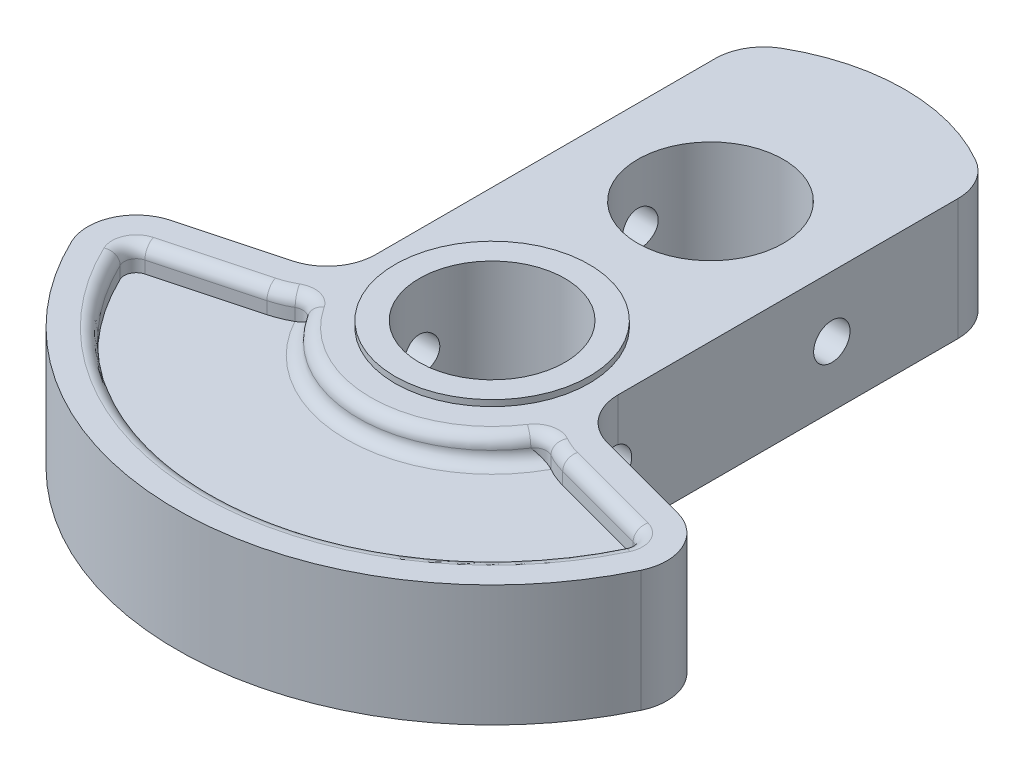
from build123d import *

# Parameters (mm, degrees)
BOSS_EXTRUDE1_DEPTH     = 5
FILLET1_R               = 4
SKETCH3_R               = 8
BOSS_EXTRUDE2_DEPTH     = 0.5
SKETCH4_R               = 8
BOSS_EXTRUDE3_DEPTH     = 0.5
SKETCH5_R               = 6
CUT_EXTRUDE2_DEPTH      = 43.969085178
CUT_EXTRUDE3_DEPTH      = 2
FILLET4_R               = 1
FILLET4_OF_MIRROR1_R    = 1
CUT_EXTRUDE4_DEPTH      = 42.899788556
CUT_EXTRUDE4_DEPTH_BACK = 42.899788556
SKETCH7_R               = 1.5


with BuildPart() as part:
    # Sketch1 → Boss-Extrude1 (new, symmetric)
    with BuildSketch(Plane(origin=(0, 0, 0), x_dir=(1, 0, 0), z_dir=(0, 1, 0))):
        with BuildLine():
            Line((-10, 30.489995997), (-10, -2.679491924))
            Line((-10, -2.679491924), (-25.114071484, -6.729295173))
            ThreePointArc((-25.114071484, -6.729295173), (0, -26), (25.114071484, -6.729295173))
            Line((25.114071484, -6.729295173), (10, -2.679491924))
            Line((10, -2.679491924), (10, 30.489995997))
            ThreePointArc((10, 30.489995997), (0, 34), (-10, 30.489995997))
        make_face()
    extrude(amount=BOSS_EXTRUDE1_DEPTH, both=True)

    # Fillet1
    fillet1_edges = [part.edges().sort_by_distance(p)[0] for p in [
        (10, 0, -30.489995997),
        (10, 0, 2.679491924),
        (25.114071484, 0, 6.729295173),
        (-25.114071484, 0, 6.729295173),
        (-10, 0, 2.679491924),
        (-10, 0, -30.489995997),
    ]]
    fillet(fillet1_edges, radius=FILLET1_R)

    # Sketch3 → Boss-Extrude2 (add, symmetric)
    with BuildSketch(Plane(origin=(0, 5, 0), x_dir=(1, 0, 0), z_dir=(0, 1, 0))):
        with Locations(Location((0, 0, 0), (0, 0, 270))):
            Circle(SKETCH3_R)
    extrude(amount=BOSS_EXTRUDE2_DEPTH, both=True)

    # Sketch4 → Boss-Extrude3 (add, symmetric)
    with BuildSketch(Plane.XZ.offset(5)):
        with Locations(Location((0, -18, 0), (0, 0, 90))):
            Circle(SKETCH4_R)
    extrude(amount=BOSS_EXTRUDE3_DEPTH, both=True)

    # Sketch5 → Cut-Extrude2 (cut, through all)
    with BuildSketch(Plane(origin=(0, 5.5, 0), x_dir=(1, 0, 0), z_dir=(0, 1, 0))):
        with Locations(Location((0, 0, 0), (0, 0, 270))):
            Circle(SKETCH5_R)
        with Locations(Location((0, 18, 0), (0, 0, 270))):
            Circle(SKETCH5_R)
    extrude(amount=-CUT_EXTRUDE2_DEPTH, mode=Mode.SUBTRACT)

    # Sketch6 → Cut-Extrude3 (cut)
    with BuildSketch(Plane.XZ.offset(5)):
        with BuildLine():
            Line((20.119713435, 8.496889508), (12.188266684, 6.371664756))
            ThreePointArc((12.188266684, 6.371664756), (10.893551196, 5.883139881), (9.720237296, 5.14946472))
            ThreePointArc((9.720237296, 5.14946472), (0, 11), (-9.720237296, 5.14946472))
            ThreePointArc((-9.720237296, 5.14946472), (-10.893551196, 5.883139881), (-12.188266684, 6.371664756))
            Line((-12.188266684, 6.371664756), (-20.119713435, 8.496889508))
            ThreePointArc((-20.119713435, 8.496889508), (-20.768948696, 9.043962883), (-20.763662316, 9.892943304))
            ThreePointArc((-20.763662316, 9.892943304), (0, 23), (20.763662316, 9.892943304))
            ThreePointArc((20.763662316, 9.892943304), (20.768948696, 9.043962883), (20.119713435, 8.496889508))
        make_face()
    cut_extrude3 = extrude(amount=-CUT_EXTRUDE3_DEPTH, mode=Mode.SUBTRACT)

    # Fillet4
    fillet4_edges = [part.edges().sort_by_distance(p)[0] for p in [
        (-9.720237296, -4, 5.14946472),
        (0, -3, 11),
        (9.720237296, -4, 5.14946472),
        (-10.893551196, -5, 5.883139881),
        (0, -5, 11),
        (10.893551196, -5, 5.883139881),
        (16.153990059, -5, 7.434277132),
        (20.768948696, -5, 9.043962883),
        (0, -5, 23),
        (-20.768948696, -5, 9.043962883),
        (-16.153990059, -5, 7.434277132),
    ]]
    fillet(fillet4_edges, radius=FILLET4_R - 0.0001)  # a hair under: the kernel refuses the full size

    # Mirror1: Cut-Extrude3 across plane
    add(cut_extrude3.mirror(Plane.ZX), mode=Mode.SUBTRACT)

    # Fillet4 of Mirror1
    fillet4_of_mirror1_edges = [part.edges().sort_by_distance(p)[0] for p in [
        (-9.720237296, 4, 5.14946472),
        (0, 3, 11),
        (9.720237296, 4, 5.14946472),
        (-10.893551196, 5, 5.883139881),
        (0, 5, 11),
        (10.893551196, 5, 5.883139881),
        (16.153990059, 5, 7.434277132),
        (20.768948696, 5, 9.043962883),
        (0, 5, 23),
        (-20.768948696, 5, 9.043962883),
        (-16.153990059, 5, 7.434277132),
    ]]
    fillet(fillet4_of_mirror1_edges, radius=FILLET4_OF_MIRROR1_R - 0.0001)  # a hair under: the kernel refuses the full size

    # Sketch7 → Cut-Extrude4 (cut, two sides: drawn at the far end of the back side and taken through both)
    with BuildSketch(Plane(origin=(0, 0, 0), x_dir=(0, 0, -1), z_dir=(1, 0, 0)).offset(-CUT_EXTRUDE4_DEPTH_BACK)):
        Circle(SKETCH7_R)
        with Locations((18, 0)):
            Circle(SKETCH7_R)
    extrude(amount=CUT_EXTRUDE4_DEPTH + CUT_EXTRUDE4_DEPTH_BACK, mode=Mode.SUBTRACT)


solid = part.part
